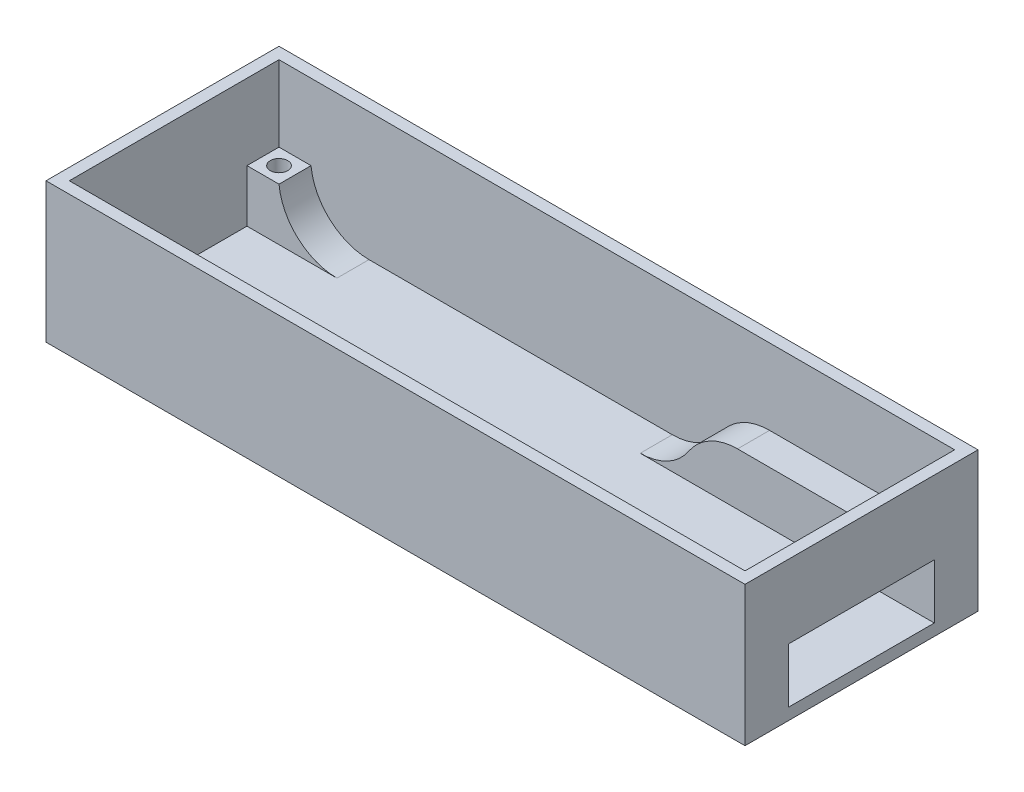
from build123d import *

# Parameters (mm, degrees)
SKETCH1_W           = 60
SKETCH1_H           = 20
BOSS_EXTRUDE1_DEPTH = 12
SHELL1_T            = -1
SKETCH2_W           = 12.5
SKETCH2_H           = 4.7
CUT_EXTRUDE1_DEPTH  = 12
SKETCH3_W           = 19.267308131
SKETCH3_H           = 2.75
SKETCH3_R           = 0.75
SKETCH3_W_2         = 2.75
BOSS_EXTRUDE2_DEPTH = 4.5
FILLET1_R           = 5
FILLET2_R           = 5


with BuildPart() as part:
    # Sketch1 → Boss-Extrude1 (new body)
    with BuildSketch(Plane(origin=(0, 0, 0), x_dir=(1, 0, 0), z_dir=(0, 1, 0))):
        Rectangle(SKETCH1_W, SKETCH1_H)
    extrude(amount=BOSS_EXTRUDE1_DEPTH)

    # Shell1
    shell1_openings = [part.faces().sort_by_distance(p)[0] for p in [
        (0, 12, 0),
    ]]
    offset(amount=SHELL1_T, openings=shell1_openings, kind=Kind.INTERSECTION)

    # Sketch2 → Cut-Extrude1 (cut)
    with BuildSketch(Plane(origin=(30, 0, 0), x_dir=(0, 0, -1), z_dir=(1, 0, 0))):
        with Locations((0, 3.35)):
            Rectangle(SKETCH2_W, SKETCH2_H)
    extrude(amount=-CUT_EXTRUDE1_DEPTH, mode=Mode.SUBTRACT)

    # Sketch3 → Boss-Extrude2 (add)
    # profile 1 of 4: a face of its own
    with BuildSketch(Plane(origin=(0, 1, 0), x_dir=(1, 0, 0), z_dir=(0, 1, 0))):
        with Locations((19.366345935, 7.625)):
            Rectangle(SKETCH3_W, SKETCH3_H)
        with Locations(Location((26.5, 7.625, 0), (0, 0, 270))):
            Circle(SKETCH3_R, mode=Mode.SUBTRACT)
    # profile 2 of 4: a face of its own
    with BuildSketch(Plane(origin=(0, 1, 0), x_dir=(1, 0, 0), z_dir=(0, 1, 0))):
        with Locations((-27.625, 7.625)):
            Rectangle(SKETCH3_W_2, SKETCH3_H)
        with Locations(Location((-27.625, 7.625, 0), (0, 0, 270))):
            Circle(SKETCH3_R, mode=Mode.SUBTRACT)
    # profile 3 of 4: a face of its own
    with BuildSketch(Plane(origin=(0, 1, 0), x_dir=(1, 0, 0), z_dir=(0, 1, 0))):
        with Locations((-27.625, -7.625)):
            Rectangle(SKETCH3_W_2, SKETCH3_H)
        with Locations(Location((-27.625, -7.625, 0), (0, 0, 90))):
            Circle(SKETCH3_R, mode=Mode.SUBTRACT)
    # profile 4 of 4: a face of its own
    with BuildSketch(Plane(origin=(0, 1, 0), x_dir=(1, 0, 0), z_dir=(0, 1, 0))):
        with Locations((19.366345935, -7.625)):
            Rectangle(SKETCH3_W, SKETCH3_H)
        with Locations(Location((26.5, -7.625, 0), (0, 0, 90))):
            Circle(SKETCH3_R, mode=Mode.SUBTRACT)
    extrude(amount=BOSS_EXTRUDE2_DEPTH)

    # Fillet1
    # the kernel refuses this fillet: 5 mm, written as the material it adds along each edge
    with BuildSketch(Plane(origin=(-26.25, 1, 9), x_dir=(1, 0, 0), z_dir=(0, 0, -1))) as fillet1_piece_1:
        with BuildLine():
            CenterArc((4.974937186, -5), FILLET1_R, 90, 84.260829523)
            Line((0, -4.5), (-0.099498744, -4.49))
            ThreePointArc((-0.099498744, -4.49), (-0.1, -2.25), (-0.1, 0))
            Line((-0.1, 0), (0, 0.1))
            Line((0, 0.1), (4.974937186, 0.1))
            Line((4.974937186, 0.1), (4.974937186, 0))
        make_face()
    extrude(amount=2.75)
    with BuildSketch(Plane(origin=(-26.25, 1, -9), x_dir=(1, 0, 0), z_dir=(0, 0, 1)), Plane(origin=(9.732691869, 1, 9), x_dir=(-1, 0, 0), z_dir=(0, 0, -1))) as fillet1_piece_2:
        with BuildLine():
            CenterArc((4.974937186, 5), FILLET1_R, 185.739170477, 84.260829523)
            Line((0, 4.5), (-0.099498744, 4.49))
            ThreePointArc((-0.099498744, 4.49), (-0.1, 2.25), (-0.1, 0))
            Line((-0.1, 0), (0, -0.1))
            Line((0, -0.1), (4.974937186, -0.1))
            Line((4.974937186, -0.1), (4.974937186, 0))
        make_face()
    extrude(amount=2.75)
    with BuildSketch(Plane(origin=(9.732691869, 1, -9), x_dir=(0, 1, 0), z_dir=(0, 0, 1))) as fillet1_piece_3:
        with BuildLine():
            CenterArc((5, 4.974937186), FILLET1_R, 180, 84.260829523)
            Line((0, 4.974937186), (-0.1, 4.974937186))
            Line((-0.1, 4.974937186), (-0.1, 0))
            Line((-0.1, 0), (0, -0.1))
            ThreePointArc((0, -0.1), (2.25, -0.1), (4.49, -0.099498744))
            Line((4.49, -0.099498744), (4.5, 0))
        make_face()
    extrude(amount=2.75)

    # Fillet2
    fillet2_edges = [part.edges().sort_by_distance(p)[0] for p in [
        (9.732691869, 5.5, -7.625),
        (9.732691869, 5.5, 7.625),
    ]]
    fillet(fillet2_edges, radius=FILLET2_R)


solid = part.part
